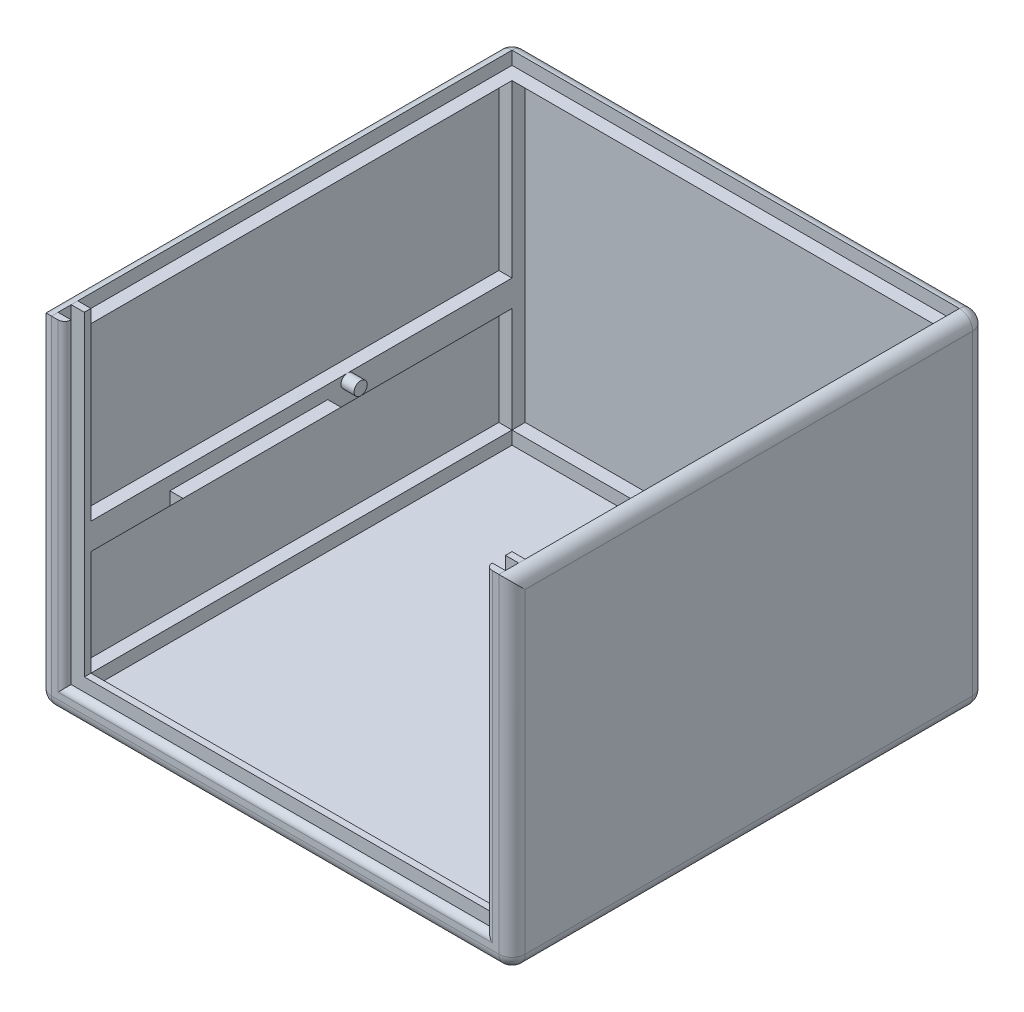
from build123d import *

# Parameters (mm, degrees)
SKETCH5_W               = 180
SKETCH5_H               = 180
SKETCH5_W_2             = 160
SKETCH5_H_2             = 160
BOSS_EXTRUDE5_DEPTH     = 10
SKETCH6_W               = 10
SKETCH6_H               = 10
BOSS_EXTRUDE6_DEPTH     = 120
SKETCH7_W               = 10
SKETCH7_H               = 10
BOSS_EXTRUDE7_DEPTH     = 177.77027879
SKETCH10_R              = 2.5
SKETCH10_W              = 60
SKETCH10_H              = 5
BOSS_EXTRUDE9_DEPTH     = 5
CUT_EXTRUDE1_DEPTH      = 212.187120819
SKETCH12_W              = 160
SKETCH12_H              = 160
BOSS_EXTRUDE10_DEPTH    = 5
SKETCH14_W              = 160
SKETCH14_H              = 120
BOSS_EXTRUDE12_DEPTH    = 5
BOSS_EXTRUDE13_DEPTH    = 170.97785486
SKETCH16_W              = 160
SKETCH16_H              = 120
BOSS_EXTRUDE14_DEPTH    = 5
SKETCH17_W              = 160
SKETCH17_H              = 120
BOSS_EXTRUDE15_DEPTH    = 5
CUT_EXTRUDE2_DEPTH      = 182.934053987
CUT_EXTRUDE2_DEPTH_BACK = 125
SKETCH18_W              = 170
SKETCH18_H              = 5
BOSS_EXTRUDE16_REACH    = 234.164
SKETCH20_W              = 5
SKETCH20_H              = 5
CUT_EXTRUDE4_DEPTH      = 5
FILLET4_R               = 5
FILLET6_R               = 2.5
SKETCH9_W               = 160
SKETCH9_H               = 160
BOSS_EXTRUDE8_DEPTH     = 5


with BuildPart() as part:
    # Sketch5 → Boss-Extrude5 (new body)
    with BuildSketch(Plane(origin=(0, 0, 0), x_dir=(1, 0, 0), z_dir=(0, 1, 0))):
        Rectangle(SKETCH5_W, SKETCH5_H)
        Rectangle(SKETCH5_W_2, SKETCH5_H_2, mode=Mode.SUBTRACT)
    extrude(amount=BOSS_EXTRUDE5_DEPTH)

    # Sketch6 → Boss-Extrude6 (add)
    with BuildSketch(Plane(origin=(0, 10, 0), x_dir=(1, 0, 0), z_dir=(0, 1, 0))):
        with Locations((85, -85)):
            Rectangle(SKETCH6_W, SKETCH6_H)
        with Locations((85, 85)):
            Rectangle(SKETCH6_W, SKETCH6_H)
        with Locations((-85, 85)):
            Rectangle(SKETCH6_W, SKETCH6_H)
        with Locations((-85, -85)):
            Rectangle(SKETCH6_W, SKETCH6_H)
    extrude(amount=BOSS_EXTRUDE6_DEPTH)

    # Sketch7 → Boss-Extrude7 (add)
    with BuildSketch(Plane.XY.offset(90)):
        with Locations((85, 55)):
            Rectangle(SKETCH7_W, SKETCH7_H)
        with Locations((-85, 55)):
            Rectangle(SKETCH7_W, SKETCH7_H)
    extrude(amount=-BOSS_EXTRUDE7_DEPTH)

    # Sketch10 → Boss-Extrude9 (add)
    with BuildSketch(Plane(origin=(-80, 0, 0), x_dir=(0, 0, -1), z_dir=(1, 0, 0))):
        with Locations(Location((17.5, 57.5, 0), (0, 0, 90))):
            Circle(SKETCH10_R)
        with Locations((-20, 52.5)):
            Rectangle(SKETCH10_W, SKETCH10_H)
    boss_extrude9 = extrude(amount=BOSS_EXTRUDE9_DEPTH)

    # Sketch11 → Cut-Extrude1 (cut, symmetric)
    with BuildSketch(Plane.XY.offset(50)):
        Polygon((-75, 55), (-80, 50), (-75, 50), align=None)
    cut_extrude1 = extrude(amount=CUT_EXTRUDE1_DEPTH, both=True, mode=Mode.SUBTRACT)

    # Mirror1: Boss-Extrude9, Cut-Extrude1 across plane
    add(boss_extrude9.mirror(Plane(origin=(0, 0, 0), x_dir=(0, 0, 1), z_dir=(1, 0, 0))))
    add(cut_extrude1.mirror(Plane(origin=(0, 0, 0), x_dir=(0, 0, 1), z_dir=(1, 0, 0))), mode=Mode.SUBTRACT)

    # Sketch12 → Boss-Extrude10 (add)
    with BuildSketch(Plane.XZ):
        Rectangle(SKETCH12_W, SKETCH12_H)
    extrude(amount=-BOSS_EXTRUDE10_DEPTH)

    # Sketch14 → Boss-Extrude12 (add)
    with BuildSketch(Plane(origin=(0, 0, -90), x_dir=(-1, 0, 0), z_dir=(0, 0, -1))):
        with Locations((0, 70)):
            Rectangle(SKETCH14_W, SKETCH14_H)
    extrude(amount=-BOSS_EXTRUDE12_DEPTH)

    # Sketch15 → Boss-Extrude13 (add)
    with BuildSketch(Plane.XY.offset(90)):
        Polygon((-90, 125), (-80, 125), (-90, 115), align=None)
        Polygon((90, 115), (90, 125), (80, 125), align=None)
    extrude(amount=-BOSS_EXTRUDE13_DEPTH)

    # Sketch16 → Boss-Extrude14 (add)
    with BuildSketch(Plane(origin=(90, 0, 0), x_dir=(0, 0, -1), z_dir=(1, 0, 0))):
        with Locations((0, 70)):
            Rectangle(SKETCH16_W, SKETCH16_H)
    extrude(amount=-BOSS_EXTRUDE14_DEPTH)

    # Sketch17 → Boss-Extrude15 (add)
    with BuildSketch(Plane.ZY.offset(90)):
        with Locations((0, 70)):
            Rectangle(SKETCH17_W, SKETCH17_H)
    extrude(amount=-BOSS_EXTRUDE15_DEPTH)

    # Sketch18 → Cut-Extrude2 (cut, two sides: drawn at the far end of the back side and taken through both)
    with BuildSketch(Plane(origin=(0, 130, 0), x_dir=(1, 0, 0), z_dir=(0, 1, 0)).offset(-CUT_EXTRUDE2_DEPTH_BACK)):
        with Locations((0, -85)):
            Rectangle(SKETCH18_W, SKETCH18_H)
    extrude(amount=CUT_EXTRUDE2_DEPTH + CUT_EXTRUDE2_DEPTH_BACK, mode=Mode.SUBTRACT)

    # Sketch19 → Boss-Extrude16 (add, up to next)
    with BuildSketch(Plane(origin=(-80, 0, 0), x_dir=(0, 0, -1), z_dir=(1, 0, 0)), mode=Mode.PRIVATE) as boss_extrude16_sk1:
        Polygon((80, 125), (85, 125), (85, 120), align=None)
    boss_extrude16_tool1 = extrude(boss_extrude16_sk1.sketch, amount=BOSS_EXTRUDE16_REACH, mode=Mode.PRIVATE) - part.part
    add(boss_extrude16_tool1.solids().sort_by_distance((-80, 123.333333, -83.333333))[0])

    # Sketch20 → Cut-Extrude4 (cut)
    with BuildSketch(Plane(origin=(0, 130, 0), x_dir=(1, 0, 0), z_dir=(0, 1, 0))):
        with Locations((-82.5, 82.5)):
            Rectangle(SKETCH20_W, SKETCH20_H)
        with Locations((82.5, 82.5)):
            Rectangle(SKETCH20_W, SKETCH20_H)
    extrude(amount=-CUT_EXTRUDE4_DEPTH, mode=Mode.SUBTRACT)

    # Fillet4
    fillet4_edges = [part.edges().sort_by_distance(p)[0] for p in [
        (90, 130, 0),
        (0, 130, -90),
        (0, 0, -90),
        (-90, 130, 0),
        (90, 0, 0),
        (0, 0, 90),
        (-90, 0, 0),
        (-90, 65, -90),
        (90, 65, -90),
        (90, 65, 90),
        (-90, 65, 90),
    ]]
    fillet(fillet4_edges, radius=FILLET4_R - 0.0001)  # a hair under: the kernel refuses the full size

    # Fillet6
    fillet6_edges = [part.edges().sort_by_distance(p)[0] for p in [
        (-80, 70, 90),
        (80, 70, 90),
        (0, 10, 90),
    ]]
    fillet(fillet6_edges, radius=FILLET6_R - 0.0001)  # a hair under: the kernel refuses the full size

    # Sketch9 → Boss-Extrude8 (add)
    with BuildSketch(Plane(origin=(0, 0, 0), x_dir=(-1, 0, 0), z_dir=(0, -1, 0))):
        Rectangle(SKETCH9_W, SKETCH9_H)
    extrude(amount=-BOSS_EXTRUDE8_DEPTH)


solid = part.part
